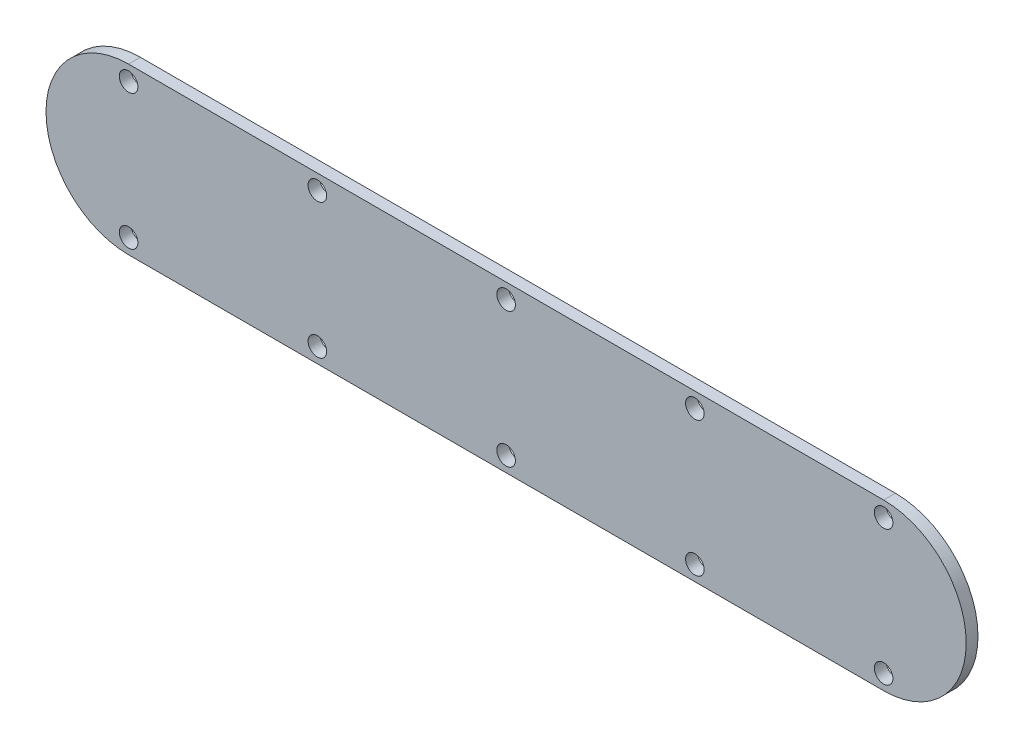
from build123d import *

# Parameters (mm, degrees)
SKETCH1_W                    = 247.65
SKETCH1_H                    = 44.45
BOSS_EXTRUDE1_DEPTH          = 3.175
CUT_EXTRUDE1_DEPTH           = 126.84379951
F_10_0_1935_DIAMETER_HOLE1_D = 4.999999906


with BuildPart() as part:
    # Sketch1 → Boss-Extrude1 (new body)
    with BuildSketch(Plane.XY):
        Rectangle(SKETCH1_W, SKETCH1_H)
    extrude(amount=BOSS_EXTRUDE1_DEPTH)

    # Sketch2 → Cut-Extrude1 (cut, through all)
    with BuildSketch(Plane.XY.offset(3.175)):
        with BuildLine():
            ThreePointArc((123.825, -6.4e-08), (117.315448189, -15.715448235), (101.6, -22.225))
            Line((101.6, -22.225), (123.825, -22.225))
            Line((123.825, -22.225), (123.825, -6.4e-08))
        make_face()
        with BuildLine():
            Line((-123.825, -22.225), (-101.6, -22.225))
            ThreePointArc((-101.6, -22.225), (-117.315448214, -15.71544821), (-123.825, 5e-09))
            Line((-123.825, 5e-09), (-123.825, -22.225))
        make_face()
        with BuildLine():
            ThreePointArc((101.6, 22.225), (117.315448235, 15.715448189), (123.825, -6.4e-08))
            Line((123.825, -6.4e-08), (123.825, 22.225))
            Line((123.825, 22.225), (101.6, 22.225))
        make_face()
        with BuildLine():
            Line((-123.825, 22.225), (-123.825, 5e-09))
            ThreePointArc((-123.825, 5e-09), (-117.31544821, 15.715448214), (-101.6, 22.225))
            Line((-101.6, 22.225), (-123.825, 22.225))
        make_face()
    extrude(amount=-CUT_EXTRUDE1_DEPTH, mode=Mode.SUBTRACT)

    # #10 (0.1935) Diameter Hole1 (through all)
    with Locations(Plane.XY.offset(3.175)):
        with Locations((-101.6, 18.161), (-50.8, 18.161), (0, 18.161), (50.8, 18.161), (101.6, 18.161), (101.6, -18.161), (50.8, -18.161), (0, -18.161), (-50.8, -18.161), (-101.6, -18.161)):
            Hole(F_10_0_1935_DIAMETER_HOLE1_D / 2)


solid = part.part
